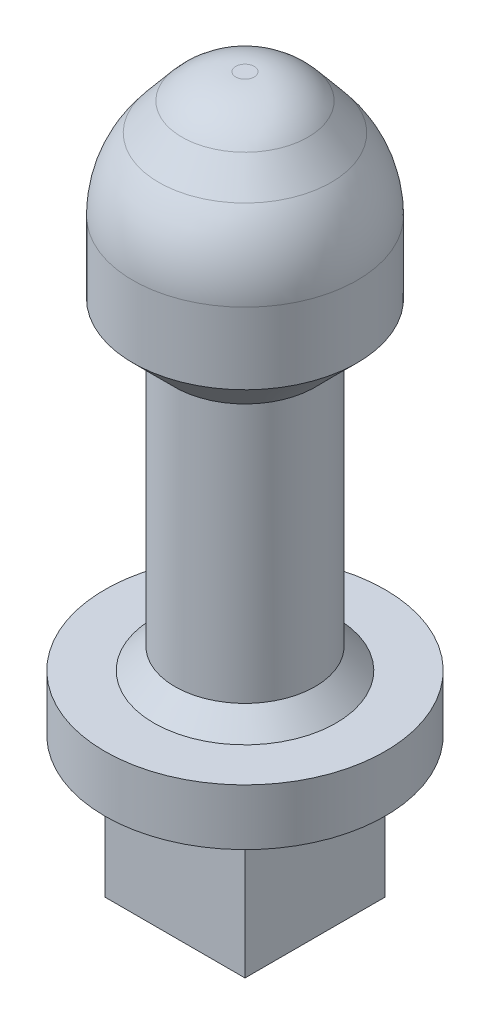
from build123d import *

# Parameters (mm, degrees)
SKETCH1_W           = 10
SKETCH1_H           = 10
BOSS_EXTRUDE1_DEPTH = 10
SKETCH2_R           = 10
BOSS_EXTRUDE2_DEPTH = 4
SKETCH3_R           = 5
BOSS_EXTRUDE3_DEPTH = 23
CHAMFER1_SIZE       = 3
SKETCH7_R           = 1.6
CUT_EXTRUDE2_DEPTH  = 6
SKETCH8_W           = 6
SKETCH8_H           = 3
CUT_EXTRUDE3_DEPTH  = 8
CUT_EXTRUDE4_REACH  = 54.924
CHAMFER2_SIZE       = 1.5


with BuildPart() as part:
    # Sketch1 → Boss-Extrude1 (new body)
    with BuildSketch(Plane(origin=(0, 0, 0), x_dir=(1, 0, 0), z_dir=(0, 1, 0))):
        Rectangle(SKETCH1_W, SKETCH1_H)
    extrude(amount=BOSS_EXTRUDE1_DEPTH)

    # Sketch2 → Boss-Extrude2 (add)
    with BuildSketch(Plane(origin=(0, 10, 0), x_dir=(1, 0, 0), z_dir=(0, 1, 0))):
        with Locations(Location((0, 0, 0), (0, 0, 270))):
            Circle(SKETCH2_R)
    extrude(amount=BOSS_EXTRUDE2_DEPTH)

    # Sketch3 → Boss-Extrude3 (add)
    with BuildSketch(Plane(origin=(0, 14, 0), x_dir=(1, 0, 0), z_dir=(0, 1, 0))):
        with Locations(Location((0, 0, 0), (0, 0, 270))):
            Circle(SKETCH3_R)
    extrude(amount=BOSS_EXTRUDE3_DEPTH)

    # Sketch4 → Revolve1 (revolve)
    with BuildSketch(Plane.XY, mode=Mode.PRIVATE) as revolve1_sk:
        with BuildLine():
            Line((0, 37), (0, 51))
            Line((0, 51), (0.65812527, 51))
            ThreePointArc((0.65812527, 51), (2.778902251, 50.527947106), (4.499231668, 49.200921998))
            Line((4.499231668, 49.200921998), (6.145770237, 47.225075716))
            ThreePointArc((6.145770237, 47.225075716), (7.522172621, 44.827002629), (8, 42.103600519))
            Line((8, 42.103600519), (8, 37))
            Line((8, 37), (0, 37))
        make_face()
    revolve(revolve1_sk.sketch.rotate(Axis((0, 37, 0), (0, 1, 0)), 90), axis=Axis((0, 37, 0), (0, 1, 0)))

    # Chamfer1
    chamfer1_edges = [part.edges().sort_by_distance(p)[0] for p in [
        (0, 37, -5),
    ]]
    chamfer(chamfer1_edges, length=CHAMFER1_SIZE - 0.0001)  # a hair under: the kernel refuses the full size

    # Sketch7 → Cut-Extrude2 (cut)
    with BuildSketch(Plane.XZ):
        with Locations(Location((0, 0, 0), (0, 0, 270))):
            Circle(SKETCH7_R)
    extrude(amount=-CUT_EXTRUDE2_DEPTH, mode=Mode.SUBTRACT)

    # Sketch8 → Cut-Extrude3 (cut)
    with BuildSketch(Plane(origin=(0, 0, -5), x_dir=(-1, 0, 0), z_dir=(0, 0, -1))):
        with Locations((0, 7.5)):
            Rectangle(SKETCH8_W, SKETCH8_H)
    extrude(amount=-CUT_EXTRUDE3_DEPTH, mode=Mode.SUBTRACT)

    # Sketch9 → Cut-Extrude4 (cut, up to next)
    with BuildSketch(Plane.XZ, mode=Mode.PRIVATE) as cut_extrude4_sk1:
        with BuildLine():
            ThreePointArc((1.6, 0), (0, -1.6), (-1.6, 0))
            Line((-1.6, 0), (-1.6, -5))
            Line((-1.6, -5), (1.6, -5))
            Line((1.6, -5), (1.6, 0))
        make_face()
    cut_extrude4_tool1 = extrude(cut_extrude4_sk1.sketch, amount=-CUT_EXTRUDE4_REACH, mode=Mode.PRIVATE) & part.part
    add(cut_extrude4_tool1.solids().sort_by_distance((0, 0, -3.111284))[0], mode=Mode.SUBTRACT)

    # Chamfer2
    chamfer2_edges = [part.edges().sort_by_distance(p)[0] for p in [
        (0, 14, -5),
    ]]
    chamfer(chamfer2_edges, length=CHAMFER2_SIZE)


solid = part.part
